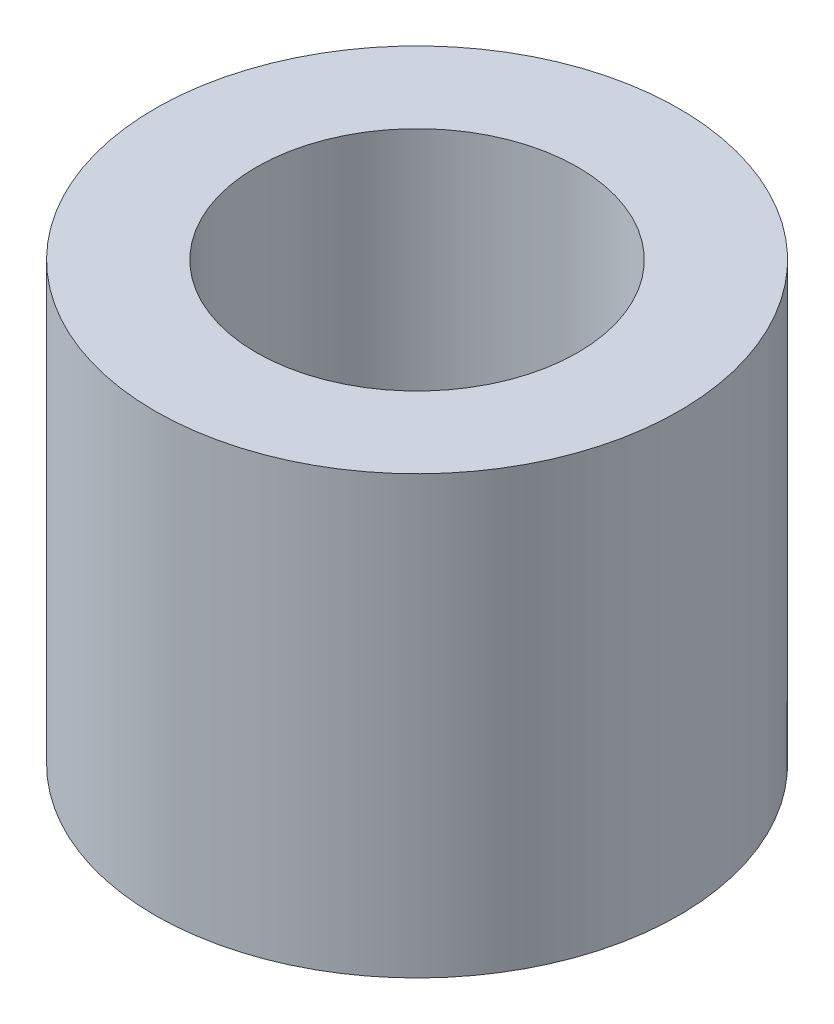
from build123d import *

# Parameters (mm, degrees)
SKETCH1_R               = 15
SKETCH1_R_2             = 2.5
BOSS_EXTRUDE1_DEPTH     = 25
G1_4_TAPPED_HOLE1_D     = 11.8
G1_4_TAPPED_HOLE1_DEPTH = 15
G1_4_TAPPED_HOLE1_TIP   = 3.545077652
SKETCH14_R              = 8.75
SKETCH14_R_2            = 2.5
CUT_EXTRUDE2_DEPTH      = 10
SKETCH11_R              = 9.2
CUT_EXTRUDE3_DEPTH      = 15


with BuildPart() as part:
    # Sketch1 → Boss-Extrude1 (new body)
    with BuildSketch(Plane(origin=(0, 0, 0), x_dir=(1, 0, 0), z_dir=(0, 1, 0))):
        Circle(SKETCH1_R)
        Circle(SKETCH1_R_2, mode=Mode.SUBTRACT)
    extrude(amount=BOSS_EXTRUDE1_DEPTH)

    # G1/4 Tapped Hole1
    with Locations(Plane(origin=(0, 25, 0), x_dir=(1, 0, 0), z_dir=(0, 1, 0))):
        with Locations((0, 0)):
            Hole(G1_4_TAPPED_HOLE1_D / 2, depth=G1_4_TAPPED_HOLE1_DEPTH)
            with Locations((0, 0, -(G1_4_TAPPED_HOLE1_DEPTH + G1_4_TAPPED_HOLE1_TIP / 2))):  # 118° drill point
                Cone(0, G1_4_TAPPED_HOLE1_D / 2, G1_4_TAPPED_HOLE1_TIP, mode=Mode.SUBTRACT)

    # Sketch14 → Cut-Extrude2 (cut)
    with BuildSketch(Plane.XZ):
        Circle(SKETCH14_R)
        Circle(SKETCH14_R_2, mode=Mode.SUBTRACT)
    extrude(amount=-CUT_EXTRUDE2_DEPTH, mode=Mode.SUBTRACT)

    # Sketch11 → Cut-Extrude3 (cut)
    with BuildSketch(Plane(origin=(0, 25, 0), x_dir=(1, 0, 0), z_dir=(0, 1, 0))):
        Circle(SKETCH11_R)
    extrude(amount=-CUT_EXTRUDE3_DEPTH, mode=Mode.SUBTRACT)


solid = part.part
